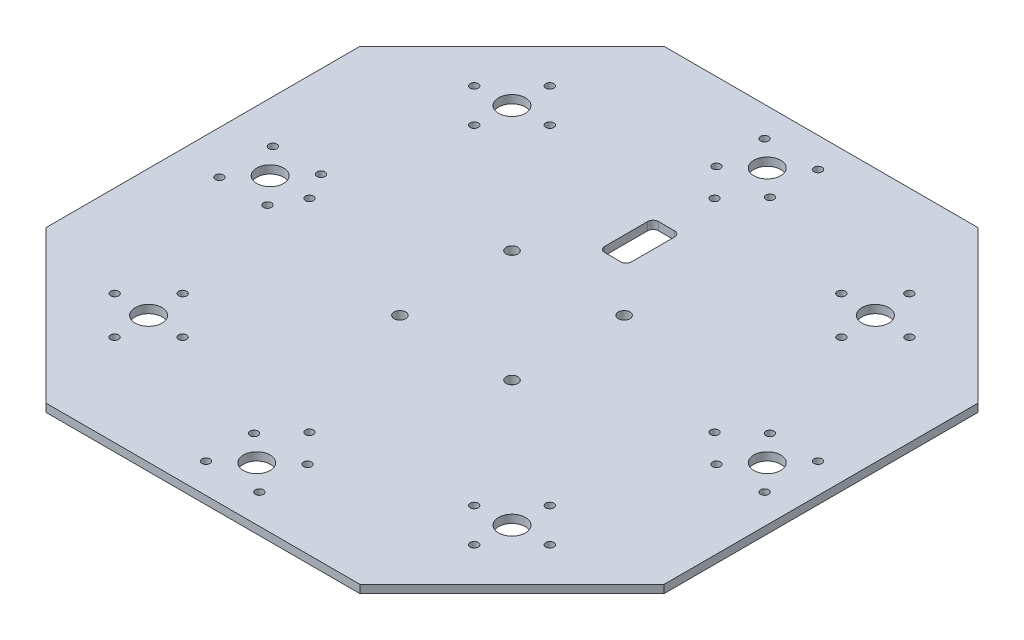
from build123d import *

# Parameters (mm, degrees)
SKETCH1_W                        = 230
SKETCH1_H                        = 230
BOSS_EXTRUDE1_DEPTH              = 3
CHAMFER2_START                   = -1
CHAMFER2_OUTLINE_W               = 82
CHAMFER2_OUTLINE_H               = 3
CHAMFER2_DEPTH                   = 40.999969952
CHAMFER3_START                   = -164
CHAMFER3_OUTLINE_W               = 83
CHAMFER3_OUTLINE_H               = 3
CHAMFER3_DEPTH                   = 41.365410279
CHAMFER4_START                   = 285.269149394
CHAMFER4_OUTLINE_W               = 82
CHAMFER4_OUTLINE_H               = 3
CHAMFER4_DEPTH                   = 40.730850606
CHAMFER5_START                   = 122.634589721
CHAMFER5_OUTLINE_W               = 83
CHAMFER5_OUTLINE_H               = 3
CHAMFER5_DEPTH                   = 41.365410279
F_11_64_0_17188_DIAMETER_HOLE1_D = 4.365752
CUT_EXTRUDE3_DEPTH               = 326.28295375
FILLET9_R                        = 2
FILLET10_R                       = 2
FILLET11_R                       = 2
FILLET12_R                       = 2
F_10_0MM_DOWEL_HOLE1_D           = 10
F_3_0MM_DOWEL_HOLE1_D            = 3
F_3_0MM_DOWEL_HOLE2_D            = 3


with BuildPart() as part:
    # Sketch1 → Boss-Extrude1 (new body)
    with BuildSketch(Plane(origin=(0, 0, 0), x_dir=(1, 0, 0), z_dir=(0, 1, 0))):
        with Locations((115, 115)):
            Rectangle(SKETCH1_W, SKETCH1_H)
    extrude(amount=BOSS_EXTRUDE1_DEPTH)

    # Chamfer2: read off the stored shape, not the designer's step
    # Chamfer2 outline → Chamfer2 (cut)
    with BuildSketch(Plane(origin=(0, 0, 0), x_dir=(0.7071067811865474, 0, 0.7071067811865477), z_dir=(0.7071067811865476, 0, -0.7071067811865476)).offset(CHAMFER2_START)):
        with Locations((0, -1.5)):
            Rectangle(CHAMFER2_OUTLINE_W, CHAMFER2_OUTLINE_H)
    extrude(amount=CHAMFER2_DEPTH, mode=Mode.SUBTRACT)

    # Chamfer3: read off the stored shape, not the designer's step
    # Chamfer3 outline → Chamfer3 (cut)
    with BuildSketch(Plane(origin=(0, 0, 0), x_dir=(0.7071067811865474, 0, -0.7071067811865477), z_dir=(0.7071067811865476, 0, 0.7071067811865476)).offset(CHAMFER3_START)):
        with Locations((162.5, 1.5)):
            Rectangle(CHAMFER3_OUTLINE_W, CHAMFER3_OUTLINE_H)
    extrude(amount=CHAMFER3_DEPTH, mode=Mode.SUBTRACT)

    # Chamfer4: read off the stored shape, not the designer's step
    # Chamfer4 outline → Chamfer4 (cut)
    with BuildSketch(Plane(origin=(0, 0, 0), x_dir=(0.7071067811865474, 0, 0.7071067811865477), z_dir=(0.7071067811865476, 0, -0.7071067811865476)).offset(CHAMFER4_START)):
        with Locations((0, -1.5)):
            Rectangle(CHAMFER4_OUTLINE_W, CHAMFER4_OUTLINE_H)
    extrude(amount=CHAMFER4_DEPTH, mode=Mode.SUBTRACT)

    # Chamfer5: read off the stored shape, not the designer's step
    # Chamfer5 outline → Chamfer5 (cut)
    with BuildSketch(Plane(origin=(0, 0, 0), x_dir=(0.7071067811865471, 0, -0.707106781186548), z_dir=(0.707106781186548, 0, 0.707106781186547)).offset(CHAMFER5_START)):
        with Locations((162.5, 1.5)):
            Rectangle(CHAMFER5_OUTLINE_W, CHAMFER5_OUTLINE_H)
    extrude(amount=CHAMFER5_DEPTH, mode=Mode.SUBTRACT)

    # 11/64 (0.17188) Diameter Hole1 (through all)
    with Locations(Plane(origin=(0, 3, 0), x_dir=(1, 0, 0), z_dir=(0, 1, 0))):
        with Locations((94.140349955, 135.859650045), (135.859650045, 135.859650045), (135.859650045, 94.140349955), (94.140349955, 94.140349955)):
            Hole(F_11_64_0_17188_DIAMETER_HOLE1_D / 2)

    # Sketch11 → Cut-Extrude3 (cut, through all)
    with BuildSketch(Plane(origin=(0, 3, 0), x_dir=(1, 0, 0), z_dir=(0, 1, 0))):
        Polygon((115, 152.5), (120, 152.5), (120, 172.5), (110, 172.5), (110, 152.5), align=None)
    extrude(amount=-CUT_EXTRUDE3_DEPTH, mode=Mode.SUBTRACT)

    # Fillet9
    fillet9_edges = [part.edges().sort_by_distance(p)[0] for p in [
        (120, 1.5, -172.5),
    ]]
    fillet(fillet9_edges, radius=FILLET9_R)

    # Fillet10
    fillet10_edges = [part.edges().sort_by_distance(p)[0] for p in [
        (110, 1.5, -172.5),
    ]]
    fillet(fillet10_edges, radius=FILLET10_R)

    # Fillet11
    fillet11_edges = [part.edges().sort_by_distance(p)[0] for p in [
        (120, 1.5, -152.5),
    ]]
    fillet(fillet11_edges, radius=FILLET11_R)

    # Fillet12
    fillet12_edges = [part.edges().sort_by_distance(p)[0] for p in [
        (110, 1.5, -152.5),
    ]]
    fillet(fillet12_edges, radius=FILLET12_R)

    # Ø10.0mm Dowel Hole1 (through all)
    with Locations(Plane(origin=(0, 3, 0), x_dir=(1, 0, 0), z_dir=(0, 1, 0))):
        with Locations((210, 115), (182.623866908, 182.623866908), (182.623866908, 47.376133092), (115, 20), (47.376133092, 47.376133092), (25, 115), (47.376133092, 182.623866908), (115, 210)):
            Hole(F_10_0MM_DOWEL_HOLE1_D / 2)

    # Ø3.0mm Dowel Hole1 (through all)
    with Locations(Plane(origin=(0, 0, 0), x_dir=(-1, 0, 0), z_dir=(0, -1, 0))):
        with Locations((-201.05, 124.95), (-201.05, 105.05), (-218.95, 124.95), (-218.95, 105.05), (-183.330973689, 60.740451256), (-169.259548744, 46.669026311), (-181.916760127, 34.011814928), (-195.988185072, 48.083239873), (-183.330973689, 169.259548744), (-169.259548744, 183.330973689), (-181.916760127, 195.988185072), (-195.988185072, 181.916760127), (-124.95, 201.05), (-124.95, 218.95), (-105.05, 218.95), (-105.05, 201.05), (-60.740451256, 183.330973689), (-34.011814928, 181.916760127), (-46.669026311, 169.259548744), (-48.083239873, 195.988185072), (-16.05, 124.95), (-33.95, 105.05), (-33.95, 124.95), (-16.05, 105.05), (-60.740451256, 46.669026311), (-48.083239873, 34.011814928), (-46.669026311, 60.740451256), (-34.011814928, 48.083239873), (-105.05, 28.95), (-105.05, 11.05), (-124.95, 28.95), (-124.95, 11.05)):
            Hole(F_3_0MM_DOWEL_HOLE1_D / 2)

    # Ø3.0mm Dowel Hole2 (through all)
    with Locations(Plane(origin=(0, 3, 0), x_dir=(1, 0, 0), z_dir=(0, 1, 0))):
        with Locations((115, 190.375), (39.625, 115), (115, 39.625), (190.375, 115)):
            Hole(F_3_0MM_DOWEL_HOLE2_D / 2)


solid = part.part
